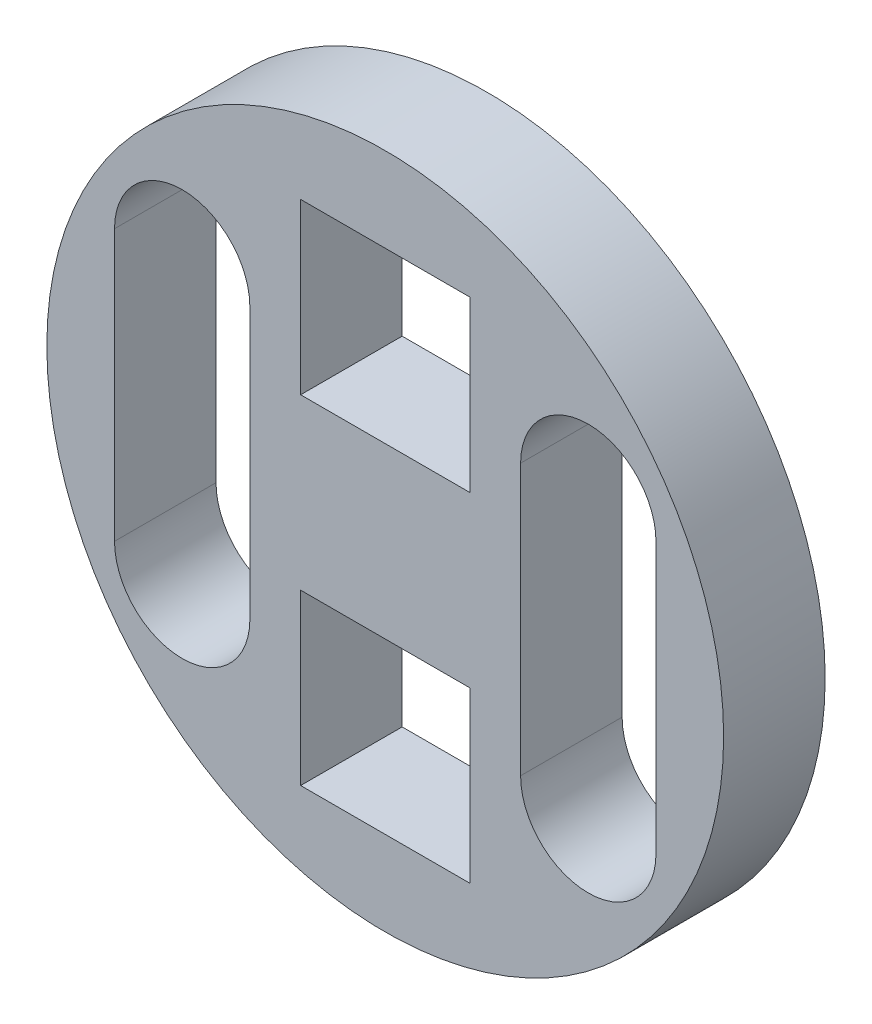
from build123d import *

# Parameters (mm, degrees)
ESQUISSE1_R        = 10
ESQUISSE1_W        = 5
ESQUISSE1_H        = 5
BOSS_EXTRU_1_DEPTH = 3


with BuildPart() as part:
    # Esquisse1 → Boss.-Extru.1 (new body)
    with BuildSketch(Plane.XY):
        Circle(ESQUISSE1_R)
        with BuildLine():
            Line((8, 4), (8, -4))
            ThreePointArc((8, -4), (6, -6), (4, -4))
            Line((4, -4), (4, 4))
            ThreePointArc((4, 4), (6, 6), (8, 4))
        make_face(mode=Mode.SUBTRACT)
        with BuildLine():
            Line((-8, 4), (-8, -4))
            ThreePointArc((-8, -4), (-6, -6), (-4, -4))
            Line((-4, -4), (-4, 4))
            ThreePointArc((-4, 4), (-6, 6), (-8, 4))
        make_face(mode=Mode.SUBTRACT)
        with Locations((0, -5)):
            Rectangle(ESQUISSE1_W, ESQUISSE1_H, mode=Mode.SUBTRACT)
        with Locations((0, 5)):
            Rectangle(ESQUISSE1_W, ESQUISSE1_H, mode=Mode.SUBTRACT)
    extrude(amount=BOSS_EXTRU_1_DEPTH)


solid = part.part
